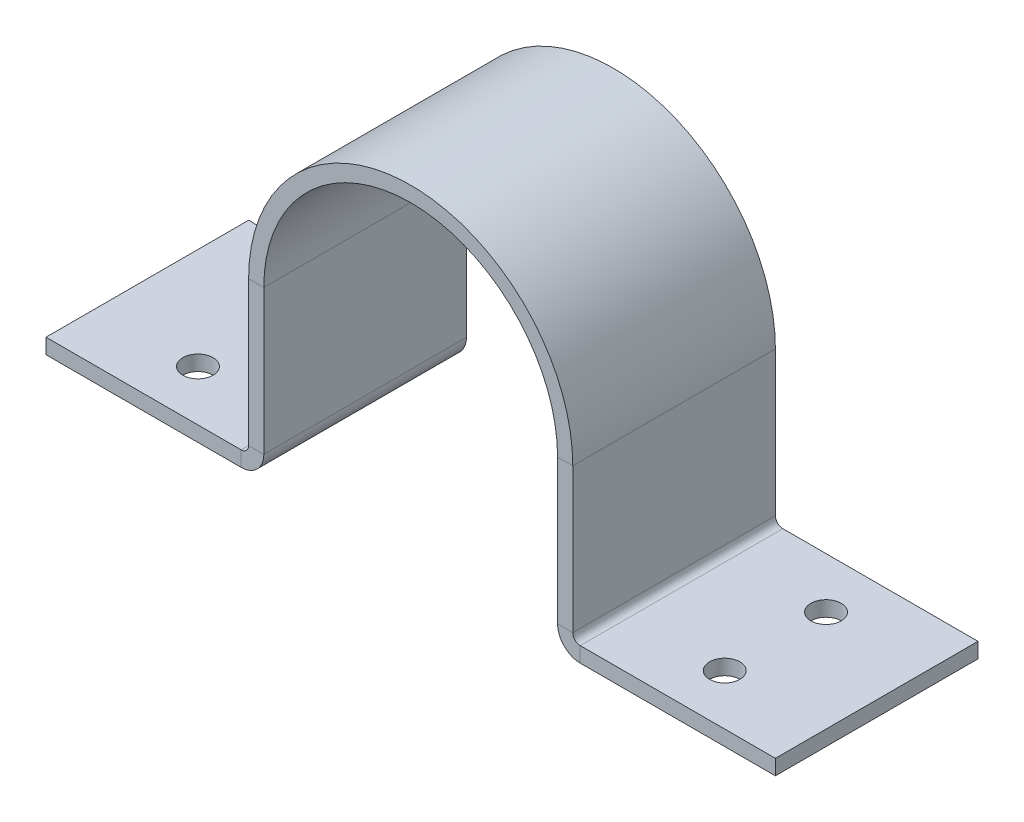
from build123d import *

# Parameters (mm, degrees)
BASE_FLANGE1_DEPTH = 20
SKETCH2_R          = 1.5
CUT_EXTRUDE1_DEPTH = 1.5
SKETCH4_R          = 1.5
CUT_EXTRUDE2_DEPTH = 1.5


# Sheet-metal steps are written as plain solids
with BuildPart() as part:
    # Sketch1 → Base-Flange1 (new body)
    with BuildSketch(Plane.XY):
        with BuildLine():
            Line((-34.427312775, 1.27753304), (-15.163912775, 1.27753304))
            ThreePointArc((-15.163912775, 1.27753304), (-14.64305792, 1.493278185), (-14.427312775, 2.01413304))
            Line((-14.427312775, 2.01413304), (-14.427312775, 16.27753304))
            ThreePointArc((-14.427312775, 16.27753304), (1.572687225, 32.27753304), (17.572687225, 16.27753304))
            Line((17.572687225, 16.27753304), (17.572687225, 2.01413304))
            ThreePointArc((17.572687225, 2.01413304), (17.78843237, 1.493278185), (18.309287225, 1.27753304))
            Line((18.309287225, 1.27753304), (37.572687225, 1.27753304))
            Line((37.572687225, 1.27753304), (37.572687225, -0.22246696))
            Line((37.572687225, -0.22246696), (18.309287225, -0.22246696))
            ThreePointArc((18.309287225, -0.22246696), (16.727772198, 0.432618013), (16.072687225, 2.01413304))
            Line((16.072687225, 2.01413304), (16.072687225, 16.27753304))
            ThreePointArc((16.072687225, 16.27753304), (1.572687225, 30.77753304), (-12.927312775, 16.27753304))
            Line((-12.927312775, 16.27753304), (-12.927312775, 2.01413304))
            ThreePointArc((-12.927312775, 2.01413304), (-13.582397749, 0.432618013), (-15.163912775, -0.22246696))
            Line((-15.163912775, -0.22246696), (-34.427312775, -0.22246696))
            Line((-34.427312775, -0.22246696), (-34.427312775, 1.27753304))
        make_face()
    extrude(amount=BASE_FLANGE1_DEPTH)

    # Sketch2 → Cut-Extrude1 (cut)
    with BuildSketch(Plane(origin=(0, 1.27753304, 0), x_dir=(1, 0, 0), z_dir=(0, 1, 0))):
        with Locations(Location((-24.427312775, -5, 0), (0, 0, 270))):
            Circle(SKETCH2_R)
        with Locations(Location((-24.427312775, -15, 0), (0, 0, 270))):
            Circle(SKETCH2_R)
    extrude(amount=-CUT_EXTRUDE1_DEPTH, mode=Mode.SUBTRACT)

    # Sketch4 → Cut-Extrude2 (cut)
    with BuildSketch(Plane(origin=(0, 1.27753304, 0), x_dir=(1, 0, 0), z_dir=(0, 1, 0))):
        with Locations(Location((27.572687225, -5, 0), (0, 0, 270))):
            Circle(SKETCH4_R)
        with Locations(Location((27.572687225, -15, 0), (0, 0, 270))):
            Circle(SKETCH4_R)
    extrude(amount=-CUT_EXTRUDE2_DEPTH, mode=Mode.SUBTRACT)


solid = part.part
